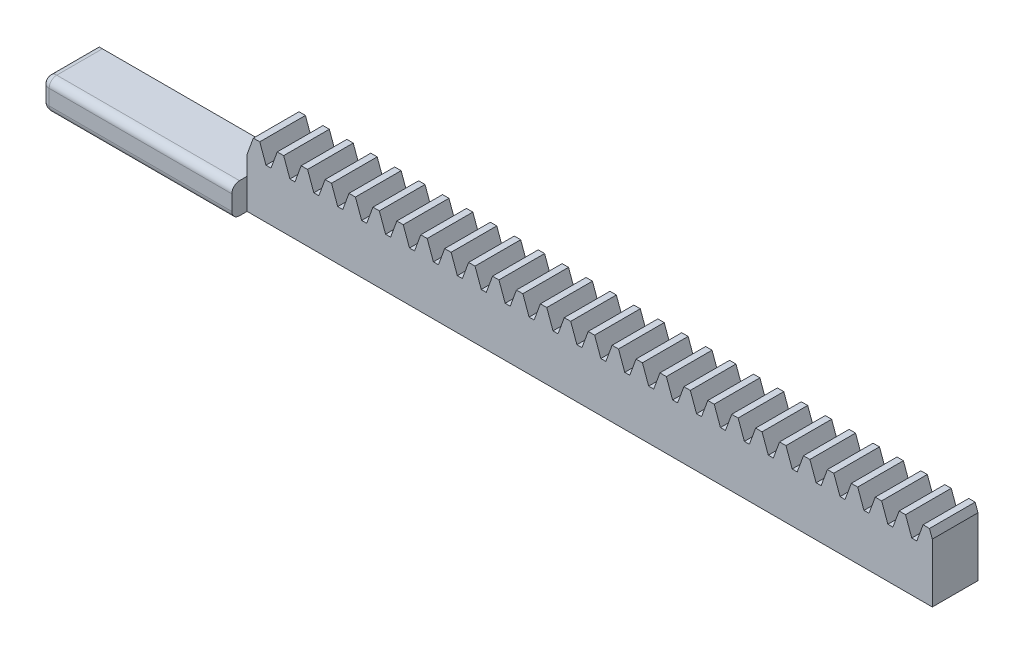
from build123d import *

# Parameters (mm, degrees)
SKETCH_1_W             = 135.088484104
SKETCH_1_H             = 6.5
EXTRUDE_1_DEPTH        = 8
EXTRUDE_2_DEPTH        = 8
PATTERN_LINEAR_1_COUNT = 43
PATTERN_LINEAR_1_PITCH = 3.141592654
SKETCH_3_OUTSIDE_W     = 164.21
SKETCH_3_OUTSIDE_H     = 37.872
SKETCH_3_OUTSIDE_W_2   = 90
SKETCH_3_OUTSIDE_H_2   = 28.626420759
CUT_EXTRUDE_1_DEPTH    = 26
SKETCH_4_W             = 8
SKETCH_4_H             = 4
EXTRUDE_1_2_DEPTH      = 115
CUT_EXTRUDE_2_DEPTH    = 2
SKETCH_7_W             = 25
SKETCH_7_H             = 4
EXTRUDE_3_DEPTH        = 2
FILLET_1_R             = 1
FILLET_2_R             = 1
CHAMFER_1_SIZE         = 1


with BuildPart() as part:
    # 草图1 → Extrude 1 (new body)
    with BuildSketch(Plane.XY):
        with Locations((67.544242052, -3.25)):
            Rectangle(SKETCH_1_W, SKETCH_1_H)
    extrude(amount=EXTRUDE_1_DEPTH)

    # 草图2 → Extrude 2 (add)
    with BuildSketch(Plane.XY.offset(8)):
        Polygon((0, 0), (0.818933027, 2.25), (1.661788885, 2.25), (2.480721912, 0), align=None)
    extrude_2 = extrude(amount=-EXTRUDE_2_DEPTH)

    # 阵列(线性)1: Extrude 2 ×43
    with Locations(*[(i * PATTERN_LINEAR_1_PITCH, 0, 0) for i in range(1, PATTERN_LINEAR_1_COUNT)]):
        add(extrude_2)

    # 草图3 outside → 切除-拉伸1 (cut)
    with BuildSketch(Plane.XY.offset(8)):
        with Locations((67.544, -2.125)):
            Rectangle(SKETCH_3_OUTSIDE_W, SKETCH_3_OUTSIDE_H)
        with Locations((45, 7.81321038)):
            Rectangle(SKETCH_3_OUTSIDE_W_2, SKETCH_3_OUTSIDE_H_2, mode=Mode.SUBTRACT)
    extrude(amount=-CUT_EXTRUDE_1_DEPTH, mode=Mode.SUBTRACT)

    # 草图4 → Extrude 1 2 (add)
    with BuildSketch(Plane(origin=(90, 0, 0), x_dir=(0, 0, -1), z_dir=(1, 0, 0))):
        with Locations((-4, -4.5)):
            Rectangle(SKETCH_4_W, SKETCH_4_H)
    extrude(amount=-EXTRUDE_1_2_DEPTH)

    # 草图5 → 切除-拉伸2 (cut)
    with BuildSketch(Plane.XY.offset(8)):
        Polygon((0, 0), (0, -2.5), (-25, -2.5), (-25, -6.5), (90, -6.5), (90, 1.22349624), (89.626383186, 2.25), (88.783527328, 2.25), (87.964594301, 0), (87.303723559, 0), (86.484790532, 2.25), (85.641934674, 2.25), (84.823001647, 0), (84.162130906, 0), (83.343197879, 2.25), (82.50034202, 2.25), (81.681408993, 0), (81.020538252, 0), (80.201605225, 2.25), (79.358749367, 2.25), (78.53981634, 0), (77.878945599, 0), (77.060012572, 2.25), (76.217156713, 2.25), (75.398223686, 0), (74.737352945, 0), (73.918419918, 2.25), (73.07556406, 2.25), (72.256631033, 0), (71.595760291, 0), (70.776827264, 2.25), (69.933971406, 2.25), (69.115038379, 0), (68.454167638, 0), (67.635234611, 2.25), (66.792378752, 2.25), (65.973445725, 0), (65.312574984, 0), (64.493641957, 2.25), (63.650786099, 2.25), (62.831853072, 0), (62.170982331, 0), (61.352049304, 2.25), (60.509193445, 2.25), (59.690260418, 0), (59.029389677, 0), (58.21045665, 2.25), (57.367600792, 2.25), (56.548667765, 0), (55.887797023, 0), (55.068863996, 2.25), (54.226008138, 2.25), (53.407075111, 0), (52.74620437, 0), (51.927271343, 2.25), (51.084415485, 2.25), (50.265482457, 0), (49.604611716, 0), (48.785678689, 2.25), (47.942822831, 2.25), (47.123889804, 0), (46.463019063, 0), (45.644086036, 2.25), (44.801230177, 2.25), (43.98229715, 0), (43.321426409, 0), (42.502493382, 2.25), (41.659637524, 2.25), (40.840704497, 0), (40.179833756, 0), (39.360900728, 2.25), (38.51804487, 2.25), (37.699111843, 0), (37.038241102, 0), (36.219308075, 2.25), (35.376452217, 2.25), (34.557519189, 0), (33.896648448, 0), (33.077715421, 2.25), (32.234859563, 2.25), (31.415926536, 0), (30.755055795, 0), (29.936122768, 2.25), (29.093266909, 2.25), (28.274333882, 0), (27.613463141, 0), (26.794530114, 2.25), (25.951674256, 2.25), (25.132741229, 0), (24.471870488, 0), (23.65293746, 2.25), (22.810081602, 2.25), (21.991148575, 0), (21.330277834, 0), (20.511344807, 2.25), (19.668488949, 2.25), (18.849555922, 0), (18.18868518, 0), (17.369752153, 2.25), (16.526896295, 2.25), (15.707963268, 0), (15.047092527, 0), (14.2281595, 2.25), (13.385303641, 2.25), (12.566370614, 0), (11.905499873, 0), (11.086566846, 2.25), (10.243710988, 2.25), (9.424777961, 0), (8.76390722, 0), (7.944974193, 2.25), (7.102118334, 2.25), (6.283185307, 0), (5.622314566, 0), (4.803381539, 2.25), (3.960525681, 2.25), (3.141592654, 0), (2.480721912, 0), (1.661788885, 2.25), (0.818933027, 2.25), align=None)
    extrude(amount=-CUT_EXTRUDE_2_DEPTH, mode=Mode.SUBTRACT)

    # 草图7 → 凸台-拉伸3 (add)
    with BuildSketch(Plane.XY.offset(6)):
        with Locations((-12.5, -4.5)):
            Rectangle(SKETCH_7_W, SKETCH_7_H)
    extrude(amount=EXTRUDE_3_DEPTH)

    # 圆角1
    fillet_1_edges = [part.edges().sort_by_distance(p)[0] for p in [
        (-12.5, -2.5, 8),
        (-12.5, -6.5, 8),
    ]]
    fillet(fillet_1_edges, radius=FILLET_1_R)

    # 圆角2
    fillet_2_edges = [part.edges().sort_by_distance(p)[0] for p in [
        (-25, -4.5, 8),
        (-25, -2.5, 3.5),
        (-25, -2.792893219, 7.707106781),
        (-25, -6.207106781, 7.707106781),
        (-25, -6.5, 3.5),
    ]]
    fillet(fillet_2_edges, radius=FILLET_2_R)

    # 倒角1
    # the kernel refuses this chamfer: 1 mm, written as the material it takes off along each edge
    with BuildSketch(Plane(origin=(0, -2.5, 0), x_dir=(0, 0.027495876610586494, 0.9996219169112968), z_dir=(-1, 0, 0))) as chamfer_1_piece_1:
        Polygon((CHAMFER_1_SIZE * 0.999621916911, -CHAMFER_1_SIZE * 0.0274958766106), (-CHAMFER_1_SIZE * 0.0274958766106, -CHAMFER_1_SIZE * 0.999621916911), (0, 0), align=None)
    extrude(amount=26.571682988, mode=Mode.SUBTRACT)


solid = part.part
